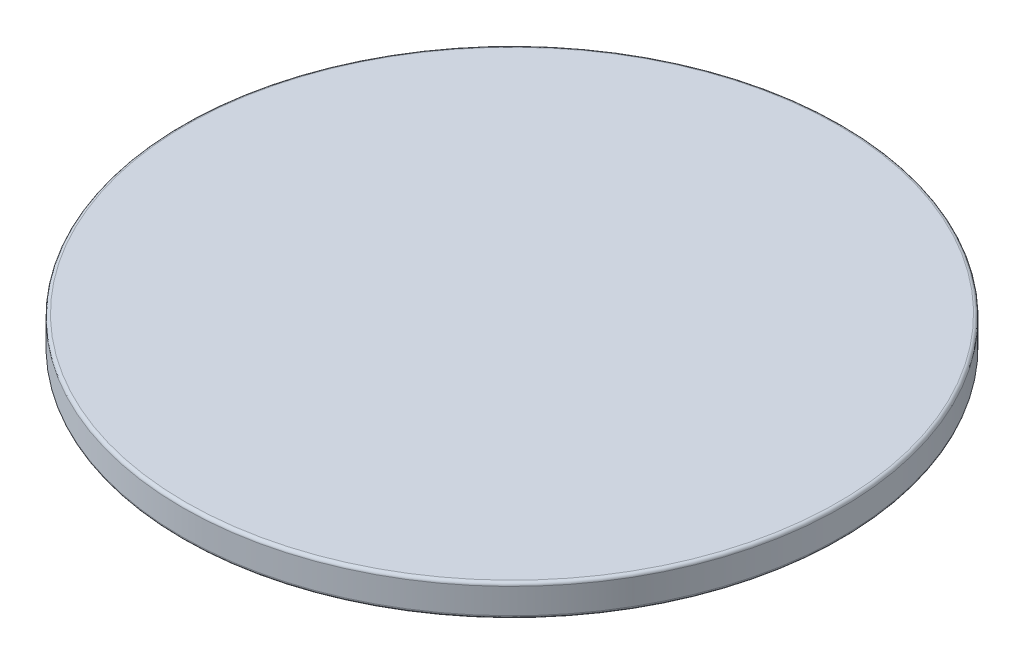
from build123d import *

# Parameters (mm, degrees)
SKETCH2_R           = 66.04
BOSS_EXTRUDE1_DEPTH = 6.35
FILLET1_R           = 0.635


with BuildPart() as part:
    # Sketch2 → Boss-Extrude1 (new body)
    with BuildSketch(Plane(origin=(0, 0, 0), x_dir=(1, 0, 0), z_dir=(0, 1, 0))):
        Circle(SKETCH2_R)
    extrude(amount=BOSS_EXTRUDE1_DEPTH)

    # Fillet1
    fillet1_edges = [part.edges().sort_by_distance(p)[0] for p in [
        (-66.04, 0, 0),
        (-66.04, 6.35, 0),
    ]]
    fillet(fillet1_edges, radius=FILLET1_R)


solid = part.part
